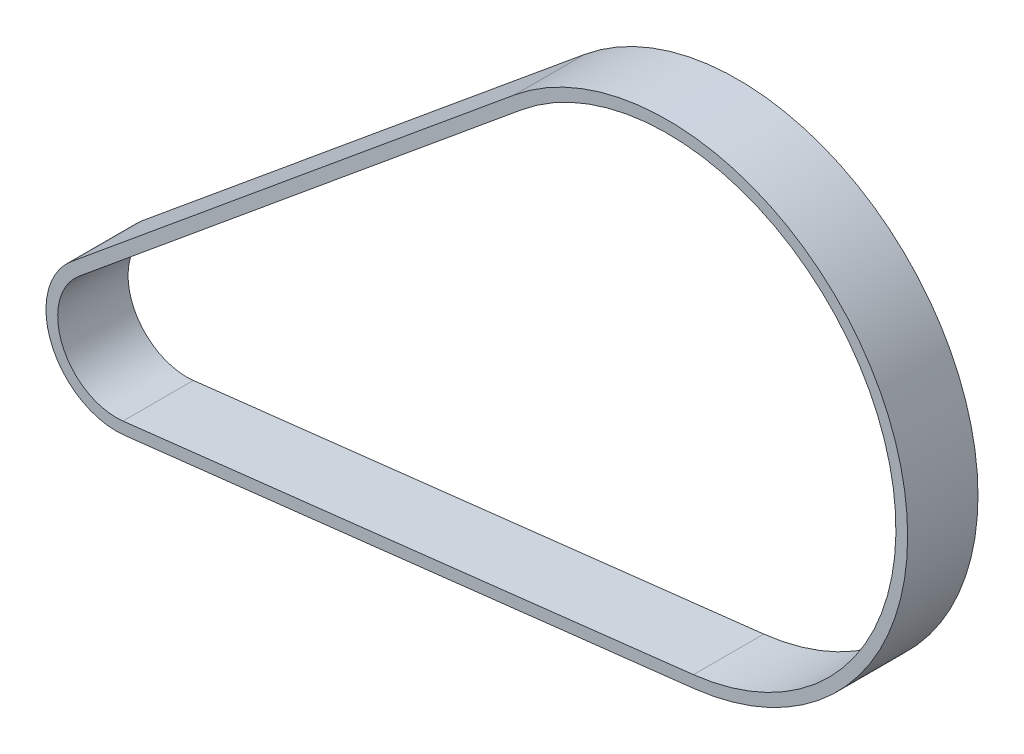
from build123d import *

# Parameters (mm, degrees)
EXTRUDE_THIN1_DEPTH = 3


with BuildPart() as part:
    # Sketch1 → Extrude-Thin1 (new, symmetric)
    with BuildSketch(Plane.XY):
        with BuildLine():
            Line((49.341830022, -0.365800553), (0.685413665, -5.960722113))
            ThreePointArc((0.685413665, -5.960722113), (-5.520927814, -2.349330985), (-3.819947969, 4.626877728))
            Line((-3.819947969, 4.626877728), (33.948511105, 35.808498904))
            ThreePointArc((33.948511105, 35.808498904), (65.86317003, 28.026880864), (49.341830022, -0.365800553))
        make_face()
        with BuildLine():
            Line((49.227594412, 0.627653133), (0.571178054, -4.967268427))
            ThreePointArc((0.571178054, -4.967268427), (-4.600773178, -1.95777582), (-3.183289975, 3.85573144))
            Line((-3.183289975, 3.85573144), (34.585169099, 35.037352616))
            ThreePointArc((34.585169099, 35.037352616), (64.943015395, 27.6353257), (49.227594412, 0.627653133))
        make_face(mode=Mode.SUBTRACT)
    extrude(amount=EXTRUDE_THIN1_DEPTH, both=True)


solid = part.part
